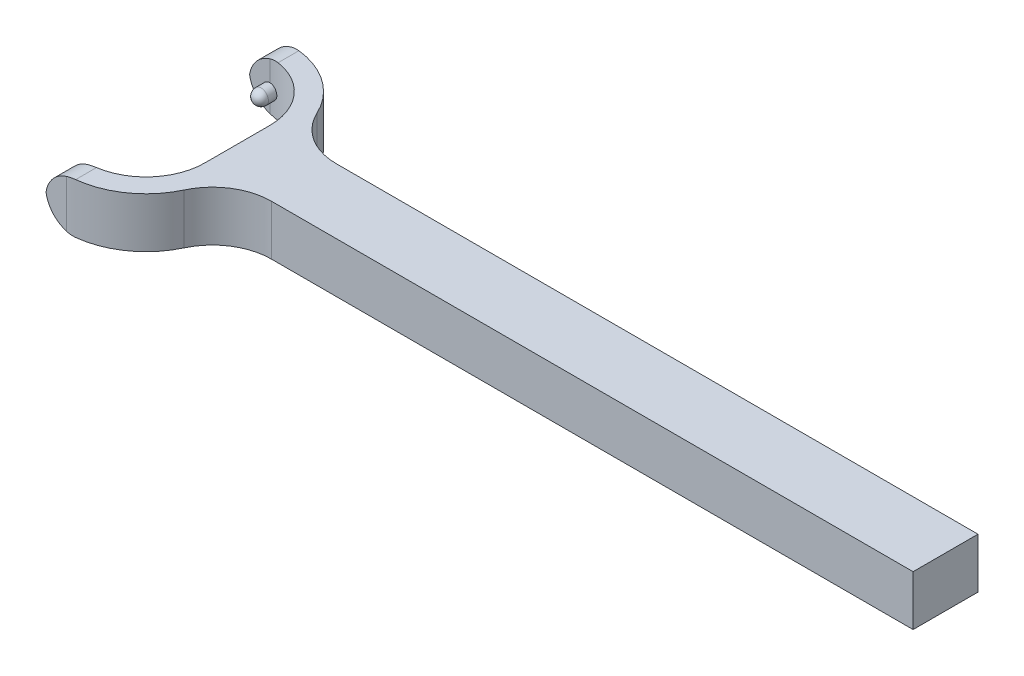
from build123d import *

# Parameters (mm, degrees)
SKETCH1_W           = 11
SKETCH1_H           = 8.5
BOSS_EXTRUDE1_DEPTH = 120
BOSS_EXTRUDE3_START = -8.5
BOSS_EXTRUDE3_DEPTH = 8.5
FILLET5_R           = 10
FILLET6_R           = 5
SKETCH18_R          = 1.25
BOSS_EXTRUDE4_DEPTH = 1.5
SKETCH19_R          = 1.25
BOSS_EXTRUDE5_DEPTH = 1.5
REVOLVE9_ANGLE      = 180
REVOLVE10_ANGLE     = 180


with BuildPart() as part:
    # Sketch1 → Boss-Extrude1 (new body)
    with BuildSketch(Plane(origin=(0, 0, 0), x_dir=(0, 0, -1), z_dir=(1, 0, 0))):
        with Locations((5.5, -4.25)):
            Rectangle(SKETCH1_W, SKETCH1_H)
    extrude(amount=BOSS_EXTRUDE1_DEPTH)

    # Sketch17 → Boss-Extrude3 (add)
    with BuildSketch(Plane(origin=(0, 0, 0), x_dir=(1, 0, 0), z_dir=(0, 1, 0)).offset(BOSS_EXTRUDE3_START)):
        with BuildLine():
            Line((-10, -10), (-13.5, -10))
            Line((-13.5, -10), (-13.5, -13.5))
            Line((-13.5, -13.5), (-10, -13.5))
            ThreePointArc((-10, -13.5), (-0.454058454, -9.545941546), (3.5, 0))
            Line((3.5, 0), (3.5, 11))
            ThreePointArc((3.5, 11), (-0.454058454, 20.545941546), (-10, 24.5))
            Line((-10, 24.5), (-13.5, 24.5))
            Line((-13.5, 24.5), (-13.5, 21))
            Line((-13.5, 21), (-10, 21))
            ThreePointArc((-10, 21), (-2.928932188, 18.071067812), (0, 11))
            Line((0, 11), (0, 0))
            ThreePointArc((0, 0), (-2.928932188, -7.071067812), (-10, -10))
        make_face()
    extrude(amount=BOSS_EXTRUDE3_DEPTH)

    # Fillet5
    fillet5_edges = [part.edges().sort_by_distance(p)[0] for p in [
        (3.5, -4.25, 0),
        (3.5, -4.25, -11),
    ]]
    fillet(fillet5_edges, radius=FILLET5_R)

    # Fillet6
    # the kernel refuses this fillet: 5 mm, written as the material it takes off along each edge
    with BuildSketch(Plane(origin=(-13.5, -8.5, -2.5), x_dir=(0, 1, 0), z_dir=(0, 0, 1)), Plane(origin=(-13.5, 0, -2.5), x_dir=(1, 0, 0), z_dir=(0, 0, 1)), Plane(origin=(-13.5, -8.5, -37), x_dir=(0, 1, 0), z_dir=(0, 0, 1)), Plane(origin=(-13.5, 0, -37), x_dir=(1, 0, 0), z_dir=(0, 0, 1))) as fillet6_piece_1:
        with BuildLine():
            CenterArc((FILLET6_R, -FILLET6_R), FILLET6_R, 90, 90)
            Line((0, -FILLET6_R), (0, 0))
            Line((0, 0), (FILLET6_R, 0))
        make_face()
    extrude(amount=28.5, mode=Mode.SUBTRACT)

    # Sketch18 → Boss-Extrude4 (add)
    with BuildSketch(Plane.XY.offset(-21)):
        with Locations(Location((-10, -5, 0), (0, 0, 270))):
            Circle(SKETCH18_R)
    extrude(amount=BOSS_EXTRUDE4_DEPTH)

    # Sketch19 → Boss-Extrude5 (add)
    with BuildSketch(Plane(origin=(0, 0, 10), x_dir=(-1, 0, 0), z_dir=(0, 0, -1))):
        with Locations(Location((10, -3.5, 0), (0, 0, 269.999999996))):
            Circle(SKETCH19_R)
    extrude(amount=BOSS_EXTRUDE5_DEPTH)

    # Sketch24 → Revolve9 (revolve)
    with BuildSketch(Plane(origin=(0, 0, 8.5), x_dir=(-1, 0, 0), z_dir=(0, 0, -1))):
        with BuildLine():
            Line((10, -2.25), (10, -4.75))
            ThreePointArc((10, -4.75), (11.25, -3.5), (10, -2.25))
        make_face()
    revolve(axis=Axis((-10, -2.25, 8.5), (0, -1, 0)), revolution_arc=REVOLVE9_ANGLE)

    # Sketch25 → Revolve10 (revolve)
    with BuildSketch(Plane.XY.offset(-19.5)):
        with BuildLine():
            Line((-10, -3.75), (-10, -6.25))
            ThreePointArc((-10, -6.25), (-11.25, -5), (-10, -3.75))
        make_face()
    revolve(axis=Axis((-10, -3.75, -19.5), (0, 1, 0)), revolution_arc=REVOLVE10_ANGLE)


solid = part.part
